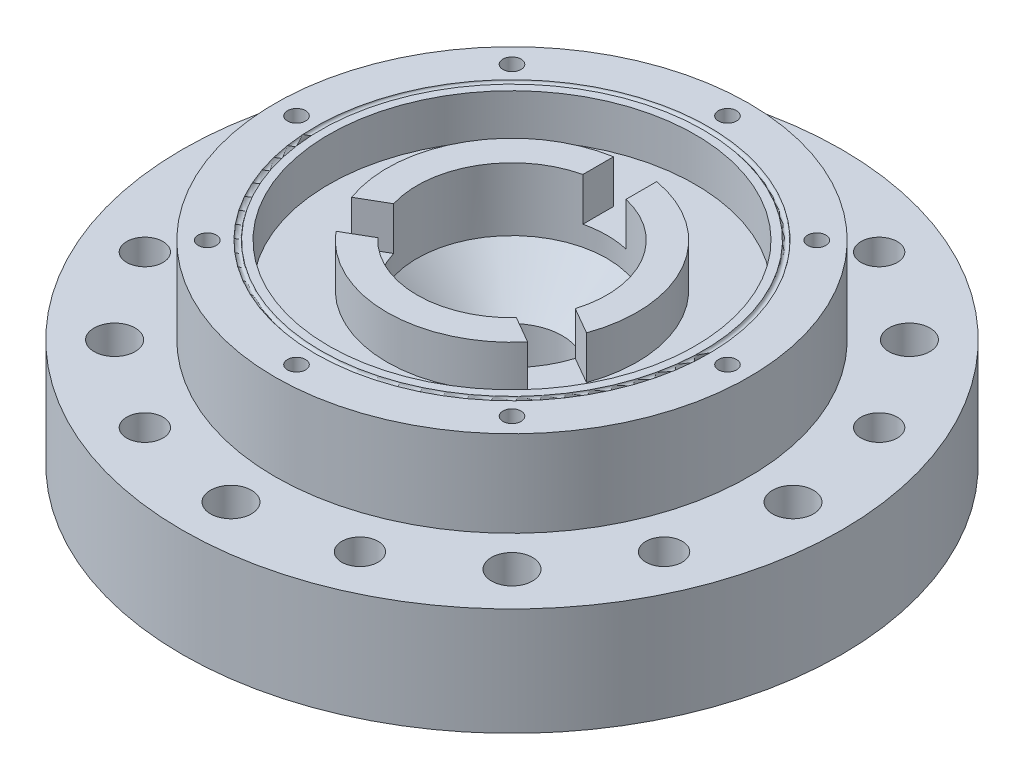
from build123d import *

# Parameters (mm, degrees)
SKETCH4_R            = 4.7625
CUT_EXTRUDE2_DEPTH   = 114.707959264
CIRPATTERN1_COUNT    = 8
SKETCH6_R            = 42.5
SKETCH6_R_2          = 29
CUT_EXTRUDE3_DEPTH   = 10
SKETCH7_W            = 10
SKETCH7_H            = 7.550043706
CUT_EXTRUDE4_DEPTH   = 10
CIRPATTERN2_COUNT    = 3
CIRPATTERN4_COUNT    = 8
CIRPATTERN5_COUNT    = 8
SKETCH25_R           = 56.85
SKETCH25_R_2         = 53.85
BOSS_EXTRUDE1_DEPTH  = 6
FILLET1_R            = 10
CUT_SWEEP1_PROFILE_R = 0.625
CUT_SWEEP2_PROFILE_R = 0.625


with BuildPart() as part:
    # Sketch3 → Revolve1 (revolve)
    with BuildSketch(Plane(origin=(0, 0, 0), x_dir=(0, 0, -1), z_dir=(1, 0, 0))):
        with BuildLine():
            Line((76.5, 15), (55, 15))
            Line((55, 15), (55, 35))
            Line((55, 35), (22.025, 35))
            Line((22.025, 35), (22.025, 20.36))
            Line((22.025, 20.36), (11.665, 10))
            Line((11.665, 10), (11.665, 0))
            Line((11.665, 0), (16.665, 0))
            ThreePointArc((16.665, 0), (37.471852779, 3.234070807), (53.85, -10))
            Line((53.85, -10), (76.5, -10))
            Line((76.5, -10), (76.5, 15))
        make_face()
    revolve(axis=Axis((0, 0, 0), (0, 1, 0)))

    # Sketch4 → Cut-Extrude2 (cut, symmetric)
    with BuildSketch(Plane(origin=(0, 0, 0), x_dir=(1, 0, 0), z_dir=(0, 1, 0))):
        with Locations((-65.2, 0)):
            Circle(SKETCH4_R)
    cut_extrude2 = extrude(amount=CUT_EXTRUDE2_DEPTH, both=True, mode=Mode.SUBTRACT)

    # CirPattern1: Cut-Extrude2 ×8 about axis
    cirpattern1_axis = Axis((0, 0, 0), (0, 1, 0))
    for i in range(1, CIRPATTERN1_COUNT):
        add(cut_extrude2.rotate(cirpattern1_axis, i * 360 / CIRPATTERN1_COUNT), mode=Mode.SUBTRACT)

    # Sketch6 → Cut-Extrude3 (cut)
    with BuildSketch(Plane(origin=(0, 35, 0), x_dir=(1, 0, 0), z_dir=(0, 1, 0))):
        Circle(SKETCH6_R)
        Circle(SKETCH6_R_2, mode=Mode.SUBTRACT)
    extrude(amount=-CUT_EXTRUDE3_DEPTH, mode=Mode.SUBTRACT)

    # Sketch7 → Cut-Extrude4 (cut)
    with BuildSketch(Plane(origin=(0, 35, 0), x_dir=(1, 0, 0), z_dir=(0, 1, 0))):
        with Locations((0, 25.224978147)):
            Rectangle(SKETCH7_W, SKETCH7_H)
    cut_extrude4 = extrude(amount=-CUT_EXTRUDE4_DEPTH, mode=Mode.SUBTRACT)

    # CirPattern2: Cut-Extrude4 ×3 about axis
    cirpattern2_axis = Axis((0, 0, 0), (0, 1, 0))
    for i in range(1, CIRPATTERN2_COUNT):
        add(cut_extrude4.rotate(cirpattern2_axis, i * 360 / CIRPATTERN2_COUNT), mode=Mode.SUBTRACT)

    # Sketch15 → Tap Drill for 3/8-24 Tap1 (revolve, cut)
    with BuildSketch(Plane(origin=(-60.23694552, 15, -24.95095979), x_dir=(0, 0, 1), z_dir=(1, 0, 0))):
        Polygon((0, 0), (0, 27.533468714), (4.2164, 25), (4.2164, 0), align=None)
    tap_drill_for_3_8_24_tap1 = revolve(axis=Axis((-60.23694552, 21.35, -24.95095979), (0, -1, 0)), mode=Mode.SUBTRACT)

    # CirPattern4: Tap Drill for 3/8-24 Tap1 ×8 about axis
    cirpattern4_axis = Axis((0, 0, 0), (0, -1, 0))
    for i in range(1, CIRPATTERN4_COUNT):
        add(tap_drill_for_3_8_24_tap1.rotate(cirpattern4_axis, i * 360 / CIRPATTERN4_COUNT), mode=Mode.SUBTRACT)

    # Sketch20 → Tap Drill for M5x0.8 Tap1 (revolve, cut)
    with BuildSketch(Plane(origin=(-50, 35, 0), x_dir=(0, 0, 1), z_dir=(1, 0, 0))):
        Polygon((0, 0), (0, 21.2618073), (2.1, 20), (2.1, 0), align=None)
    tap_drill_for_m5x0_8_tap1 = revolve(axis=Axis((-50, 41.35, 0), (0, -1, 0)), mode=Mode.SUBTRACT)

    # CirPattern5: Tap Drill for M5x0.8 Tap1 ×8 about axis
    cirpattern5_axis = Axis((0, 0, 0), (0, -1, 0))
    for i in range(1, CIRPATTERN5_COUNT):
        add(tap_drill_for_m5x0_8_tap1.rotate(cirpattern5_axis, i * 360 / CIRPATTERN5_COUNT), mode=Mode.SUBTRACT)

    # Sketch25 → Boss-Extrude1 (add)
    with BuildSketch(Plane.XZ.offset(10)):
        Circle(SKETCH25_R)
        Circle(SKETCH25_R_2, mode=Mode.SUBTRACT)
    extrude(amount=BOSS_EXTRUDE1_DEPTH)

    # Fillet1
    fillet1_edges = [part.edges().sort_by_distance(p)[0] for p in [
        (-38.077700167, -10, 38.077700167),
    ]]
    fillet(fillet1_edges, radius=FILLET1_R)

    # Cut-Sweep1: sweep along a path in Sketch26
    with BuildLine(Plane.XZ.offset(10)) as cut_sweep1_path:
        CenterArc((0, 0), 58, 0, 360)
    # Cut-Sweep1 profile (on start of the path) → Cut-Sweep1 (sweep, cut)
    with BuildSketch(Plane(origin=(58, -10, 0), x_dir=(1, 0, 0), z_dir=(0, 0, 1))):
        Circle(CUT_SWEEP1_PROFILE_R)
    sweep(path=cut_sweep1_path.line, mode=Mode.SUBTRACT)

    # Cut-Sweep2: sweep along a path in Sketch10
    with BuildLine(Plane(origin=(0, 35, 0), x_dir=(1, 0, 0), z_dir=(0, 1, 0))) as cut_sweep2_path:
        CenterArc((0, 0), 45, 0, 360)
    # Cut-Sweep2 profile (on start of the path) → Cut-Sweep2 (sweep, cut)
    with BuildSketch(Plane(origin=(45, 35, 0), x_dir=(-1, 0, 0), z_dir=(0, 0, -1))):
        Circle(CUT_SWEEP2_PROFILE_R)
    sweep(path=cut_sweep2_path.line, mode=Mode.SUBTRACT)


solid = part.part
